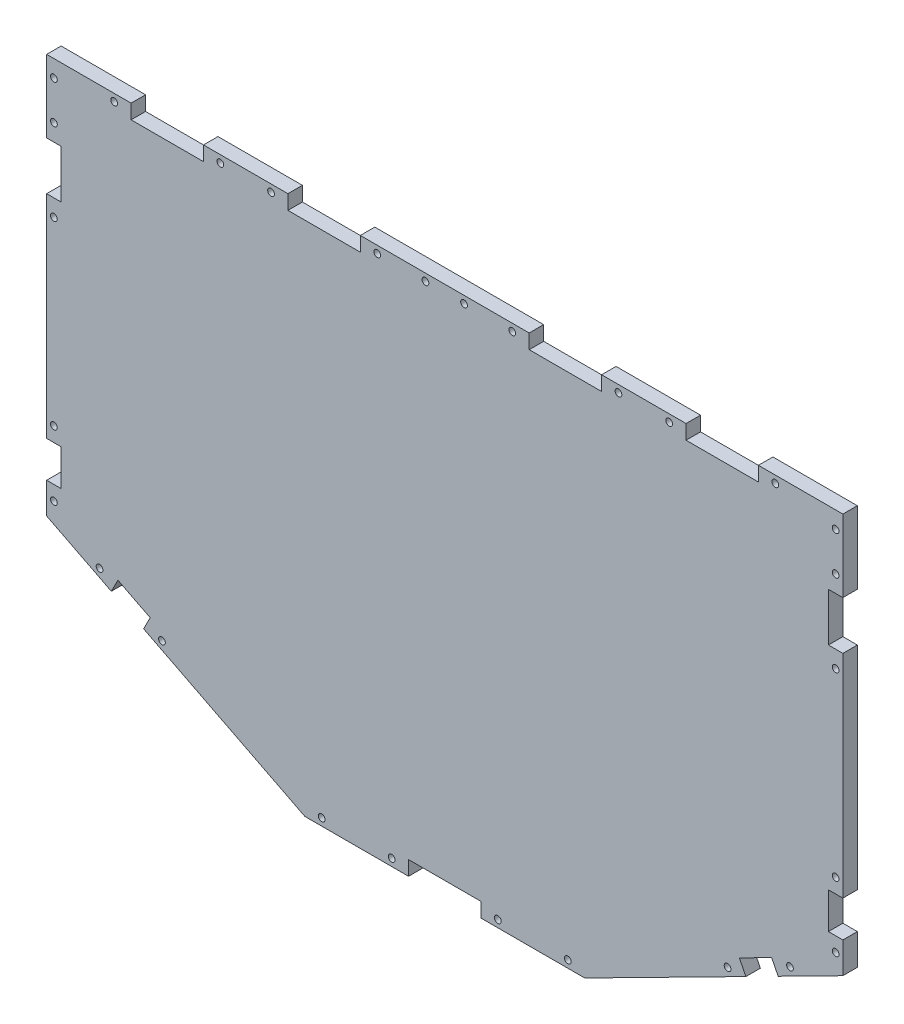
from build123d import *

# Parameters (mm, degrees)
BOSS_EXTRU_1_DEPTH      = 6
ESQUISSE8_W             = 6
ESQUISSE8_H             = 15
ESQUISSE8_H_2           = 20
ESQUISSE8_W_2           = 30
ESQUISSE8_H_3           = 6
ENL_V_MAT_EXTRU_2_DEPTH = 6
ESQUISSE9_R             = 1.4
ENL_V_MAT_EXTRU_3_DEPTH = 6


with BuildPart() as part:
    # Esquisse1 → Boss.-Extru.1 (new body)
    with BuildSketch(Plane.XY):
        Polygon((-165, 110.011553711), (165, 110.011553711), (165, -55.688446289), (58, -110.011553711), (-58, -110.011553711), (-165, -55.688446289), align=None)
    extrude(amount=BOSS_EXTRU_1_DEPTH)

    # Esquisse8 → Enlèv. mat.-Extru.2 (cut)
    with BuildSketch(Plane.XY.offset(6)):
        with Locations((-162, -35.348446289)):
            Rectangle(ESQUISSE8_W, ESQUISSE8_H)
        with Locations((-162, 70.011553711)):
            Rectangle(ESQUISSE8_W, ESQUISSE8_H_2)
        with Locations((-115, 107.011553711)):
            Rectangle(ESQUISSE8_W_2, ESQUISSE8_H_3)
        with Locations((-50, 107.011553711)):
            Rectangle(ESQUISSE8_W_2, ESQUISSE8_H_3)
        with Locations((162, -35.348446289)):
            Rectangle(ESQUISSE8_W, ESQUISSE8_H)
        with Locations((50, 107.011553711)):
            Rectangle(ESQUISSE8_W_2, ESQUISSE8_H_3)
        with Locations((115, 107.011553711)):
            Rectangle(ESQUISSE8_W_2, ESQUISSE8_H_3)
        with Locations((162, 70.011553711)):
            Rectangle(ESQUISSE8_W, ESQUISSE8_H_2)
        with Locations((0, -107.011553711)):
            Rectangle(ESQUISSE8_W_2, ESQUISSE8_H_3)
        Polygon((-138.187583333, -69.300911624), (-124.812583333, -76.091300052), (-122.096427962, -70.741300052), (-135.471427962, -63.950911624), align=None)
        Polygon((135.471427962, -63.950911624), (122.096427962, -70.741300052), (124.812583333, -76.091300052), (138.187583333, -69.300911624), align=None)
    extrude(amount=-ENL_V_MAT_EXTRU_2_DEPTH, mode=Mode.SUBTRACT)

    # Esquisse9 → Enlèv. mat.-Extru.3 (cut)
    with BuildSketch(Plane.XY.offset(6)):
        with Locations((-162, -48.848446289)):
            Circle(ESQUISSE9_R)
        with Locations((-162, -21.848446289)):
            Circle(ESQUISSE9_R)
        with Locations((-162, 53.011553711)):
            Circle(ESQUISSE9_R)
        with Locations((-162, 87.011553711)):
            Circle(ESQUISSE9_R)
        with Locations((-162, 103.011553711)):
            Circle(ESQUISSE9_R)
        with Locations((-137, 107.011553711)):
            Circle(ESQUISSE9_R)
        with Locations((-93, 107.011553711)):
            Circle(ESQUISSE9_R)
        with Locations((-72, 107.011553711)):
            Circle(ESQUISSE9_R)
        with Locations((-28, 107.011553711)):
            Circle(ESQUISSE9_R)
        with Locations((-8, 107.011553711)):
            Circle(ESQUISSE9_R)
        with Locations((8, 107.011553711)):
            Circle(ESQUISSE9_R)
        with Locations((28, 107.011553711)):
            Circle(ESQUISSE9_R)
        with Locations((72, 107.011553711)):
            Circle(ESQUISSE9_R)
        with Locations((93, 107.011553711)):
            Circle(ESQUISSE9_R)
        with Locations((137, 107.011553711)):
            Circle(ESQUISSE9_R)
        with Locations((162, 103.011553711)):
            Circle(ESQUISSE9_R)
        with Locations((162, 87.011553711)):
            Circle(ESQUISSE9_R)
        with Locations((162, 53.011553711)):
            Circle(ESQUISSE9_R)
        with Locations((162, -21.848446289)):
            Circle(ESQUISSE9_R)
        with Locations((162, -48.848446289)):
            Circle(ESQUISSE9_R)
        with Locations((-51, -107.011553711)):
            Circle(ESQUISSE9_R)
        with Locations((-22, -107.011553711)):
            Circle(ESQUISSE9_R)
        with Locations((22, -107.011553711)):
            Circle(ESQUISSE9_R)
        with Locations((51, -107.011553711)):
            Circle(ESQUISSE9_R)
        with Locations((-143.071172314, -63.457063691)):
            Circle(ESQUISSE9_R)
        with Locations((-117.212838981, -76.585147985)):
            Circle(ESQUISSE9_R)
        with Locations((117.212838981, -76.585147985)):
            Circle(ESQUISSE9_R)
        with Locations((143.071172314, -63.457063691)):
            Circle(ESQUISSE9_R)
    extrude(amount=-ENL_V_MAT_EXTRU_3_DEPTH, mode=Mode.SUBTRACT)


solid = part.part
